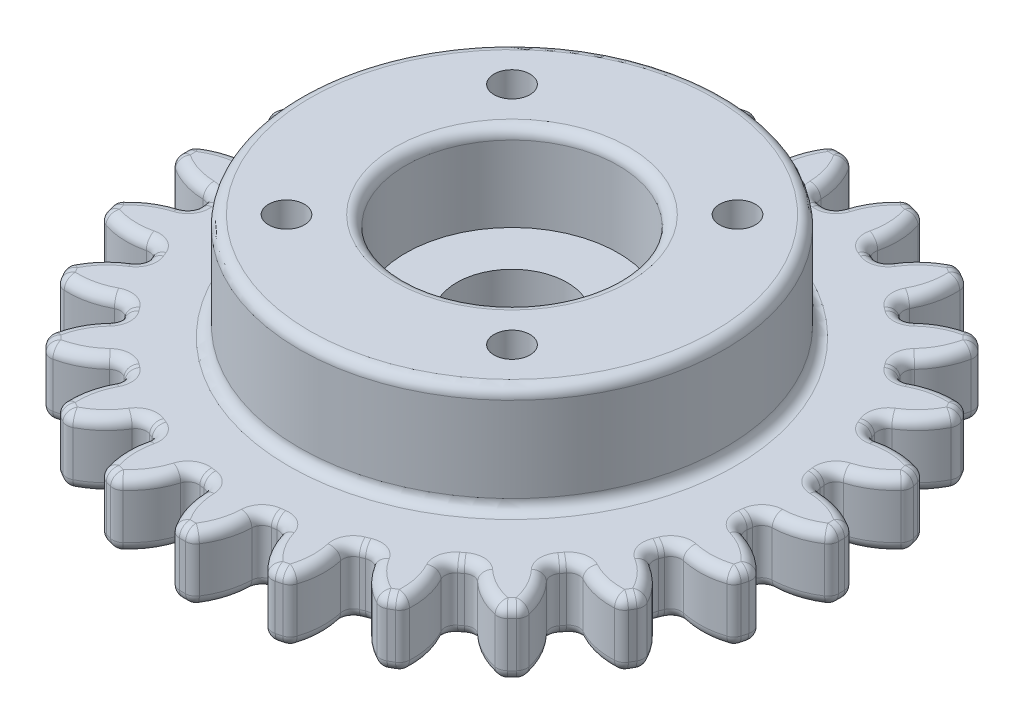
from build123d import *

# Parameters (mm, degrees)
BOSS_EXTRUDE1_DEPTH = 5
SKETCH3_R           = 4.15
CUT_EXTRUDE1_DEPTH  = 36.424021669
SKETCH4_R           = 16
SKETCH4_R_2         = 8
BOSS_EXTRUDE2_DEPTH = 8
SKETCH5_R           = 1.35
CUT_EXTRUDE2_DEPTH  = 6
SKETCH6_R           = 8
SKETCH6_R_2         = 4.15
BOSS_EXTRUDE3_DEPTH = 1.5
FILLET2_R           = 0.8


with BuildPart() as part:
    # Sketch2 → Boss-Extrude1 (new body)
    with BuildSketch(Plane(origin=(0, 0, 0), x_dir=(1, 0, 0), z_dir=(0, 1, 0))):
        with BuildLine():
            ThreePointArc((3.611499267, 20.481830133), (2.714657037, 20.619867355), (1.812647304, 20.718653487))
            ThreePointArc((1.812647304, 20.718653487), (1.606649612, 22.861926713), (0.646923861, 24.78935548))
            ThreePointArc((0.646923861, 24.78935548), (0, 24.797795378), (-0.646923861, 24.78935548))
            ThreePointArc((-0.646923861, 24.78935548), (-1.606649612, 22.861926713), (-1.812647304, 20.718653487))
            ThreePointArc((-1.812647304, 20.718653487), (-2.714657037, 20.619867355), (-3.611499267, 20.481830133))
            ThreePointArc((-3.611499267, 20.481830133), (-4.365197687, 22.498756969), (-5.791076849, 24.112114891))
            ThreePointArc((-5.791076849, 24.112114891), (-6.41814172, 23.95283099), (-7.040837779, 23.777242459))
            ThreePointArc((-7.040837779, 23.777242459), (-7.469006395, 21.667093932), (-7.113264956, 19.543534845))
            ThreePointArc((-7.113264956, 19.543534845), (-7.958971721, 19.214657471), (-8.78952813, 18.849203904))
            ThreePointArc((-8.78952813, 18.849203904), (-10.039563977, 20.602334119), (-11.834425242, 21.791673519))
            ThreePointArc((-11.834425242, 21.791673519), (-12.398897689, 21.475520755), (-12.954930238, 21.144749659))
            ThreePointArc((-12.954930238, 21.144749659), (-12.822362735, 18.995684507), (-11.929125357, 17.0365566))
            ThreePointArc((-11.929125357, 17.0365566), (-12.660895634, 16.500000433), (-13.368565177, 15.932035578))
            ThreePointArc((-13.368565177, 15.932035578), (-15.029750574, 17.301896245), (-17.071277112, 17.98616561))
            ThreePointArc((-17.071277112, 17.98616561), (-17.53468927, 17.53468927), (-17.98616561, 17.071277112))
            ThreePointArc((-17.98616561, 17.071277112), (-17.301896245, 15.029750574), (-15.932035578, 13.368565177))
            ThreePointArc((-15.932035578, 13.368565177), (-16.500000433, 12.660895634), (-17.0365566, 11.929125357))
            ThreePointArc((-17.0365566, 11.929125357), (-18.995684507, 12.822362735), (-21.144749659, 12.954930238))
            ThreePointArc((-21.144749659, 12.954930238), (-21.475520755, 12.398897689), (-21.791673519, 11.834425242))
            ThreePointArc((-21.791673519, 11.834425242), (-20.602334119, 10.039563977), (-18.849203904, 8.78952813))
            ThreePointArc((-18.849203904, 8.78952813), (-19.214657471, 7.958971721), (-19.543534845, 7.113264956))
            ThreePointArc((-19.543534845, 7.113264956), (-21.667093932, 7.469006395), (-23.777242459, 7.040837779))
            ThreePointArc((-23.777242459, 7.040837779), (-23.95283099, 6.41814172), (-24.112114891, 5.791076849))
            ThreePointArc((-24.112114891, 5.791076849), (-22.498756969, 4.365197687), (-20.481830133, 3.611499267))
            ThreePointArc((-20.481830133, 3.611499267), (-20.619867355, 2.714657037), (-20.718653487, 1.812647304))
            ThreePointArc((-20.718653487, 1.812647304), (-22.861926713, 1.606649612), (-24.78935548, 0.646923861))
            ThreePointArc((-24.78935548, 0.646923861), (-24.797795378, 0), (-24.78935548, -0.646923861))
            ThreePointArc((-24.78935548, -0.646923861), (-22.861926713, -1.606649612), (-20.718653487, -1.812647304))
            ThreePointArc((-20.718653487, -1.812647304), (-20.619867355, -2.714657037), (-20.481830133, -3.611499267))
            ThreePointArc((-20.481830133, -3.611499267), (-22.498756969, -4.365197687), (-24.112114891, -5.791076849))
            ThreePointArc((-24.112114891, -5.791076849), (-23.95283099, -6.41814172), (-23.777242459, -7.040837779))
            ThreePointArc((-23.777242459, -7.040837779), (-21.667093932, -7.469006395), (-19.543534845, -7.113264956))
            ThreePointArc((-19.543534845, -7.113264956), (-19.214657471, -7.958971721), (-18.849203904, -8.78952813))
            ThreePointArc((-18.849203904, -8.78952813), (-20.602334119, -10.039563977), (-21.791673519, -11.834425242))
            ThreePointArc((-21.791673519, -11.834425242), (-21.475520755, -12.398897689), (-21.144749659, -12.954930238))
            ThreePointArc((-21.144749659, -12.954930238), (-18.995684507, -12.822362735), (-17.0365566, -11.929125357))
            ThreePointArc((-17.0365566, -11.929125357), (-16.500000433, -12.660895634), (-15.932035578, -13.368565177))
            ThreePointArc((-15.932035578, -13.368565177), (-17.301896245, -15.029750574), (-17.98616561, -17.071277112))
            ThreePointArc((-17.98616561, -17.071277112), (-17.53468927, -17.53468927), (-17.071277112, -17.98616561))
            ThreePointArc((-17.071277112, -17.98616561), (-15.029750574, -17.301896245), (-13.368565177, -15.932035578))
            ThreePointArc((-13.368565177, -15.932035578), (-12.660895634, -16.500000433), (-11.929125357, -17.0365566))
            ThreePointArc((-11.929125357, -17.0365566), (-12.822362735, -18.995684507), (-12.954930238, -21.144749659))
            ThreePointArc((-12.954930238, -21.144749659), (-12.398897689, -21.475520755), (-11.834425242, -21.791673519))
            ThreePointArc((-11.834425242, -21.791673519), (-10.039563977, -20.602334119), (-8.78952813, -18.849203904))
            ThreePointArc((-8.78952813, -18.849203904), (-7.958971721, -19.214657471), (-7.113264956, -19.543534845))
            ThreePointArc((-7.113264956, -19.543534845), (-7.469006395, -21.667093932), (-7.040837779, -23.777242459))
            ThreePointArc((-7.040837779, -23.777242459), (-6.41814172, -23.95283099), (-5.791076849, -24.112114891))
            ThreePointArc((-5.791076849, -24.112114891), (-4.365197687, -22.498756969), (-3.611499267, -20.481830133))
            ThreePointArc((-3.611499267, -20.481830133), (-2.714657037, -20.619867355), (-1.812647304, -20.718653487))
            ThreePointArc((-1.812647304, -20.718653487), (-1.606649612, -22.861926713), (-0.646923861, -24.78935548))
            ThreePointArc((-0.646923861, -24.78935548), (0, -24.797795378), (0.646923861, -24.78935548))
            ThreePointArc((0.646923861, -24.78935548), (1.606649612, -22.861926713), (1.812647304, -20.718653487))
            ThreePointArc((1.812647304, -20.718653487), (2.714657037, -20.619867355), (3.611499267, -20.481830133))
            ThreePointArc((3.611499267, -20.481830133), (4.365197687, -22.498756969), (5.791076849, -24.112114891))
            ThreePointArc((5.791076849, -24.112114891), (6.41814172, -23.95283099), (7.040837779, -23.777242459))
            ThreePointArc((7.040837779, -23.777242459), (7.469006395, -21.667093932), (7.113264956, -19.543534845))
            ThreePointArc((7.113264956, -19.543534845), (7.958971721, -19.214657471), (8.78952813, -18.849203904))
            ThreePointArc((8.78952813, -18.849203904), (10.039563977, -20.602334119), (11.834425242, -21.791673519))
            ThreePointArc((11.834425242, -21.791673519), (12.398897689, -21.475520755), (12.954930238, -21.144749659))
            ThreePointArc((12.954930238, -21.144749659), (12.822362735, -18.995684507), (11.929125357, -17.0365566))
            ThreePointArc((11.929125357, -17.0365566), (12.660895634, -16.500000433), (13.368565177, -15.932035578))
            ThreePointArc((13.368565177, -15.932035578), (15.029750574, -17.301896245), (17.071277112, -17.98616561))
            ThreePointArc((17.071277112, -17.98616561), (17.53468927, -17.53468927), (17.98616561, -17.071277112))
            ThreePointArc((17.98616561, -17.071277112), (17.301896245, -15.029750574), (15.932035578, -13.368565177))
            ThreePointArc((15.932035578, -13.368565177), (16.500000433, -12.660895634), (17.0365566, -11.929125357))
            ThreePointArc((17.0365566, -11.929125357), (18.995684507, -12.822362735), (21.144749659, -12.954930238))
            ThreePointArc((21.144749659, -12.954930238), (21.475520755, -12.398897689), (21.791673519, -11.834425242))
            ThreePointArc((21.791673519, -11.834425242), (20.602334119, -10.039563977), (18.849203904, -8.78952813))
            ThreePointArc((18.849203904, -8.78952813), (19.214657471, -7.958971721), (19.543534845, -7.113264956))
            ThreePointArc((19.543534845, -7.113264956), (21.667093932, -7.469006395), (23.777242459, -7.040837779))
            ThreePointArc((23.777242459, -7.040837779), (23.95283099, -6.41814172), (24.112114891, -5.791076849))
            ThreePointArc((24.112114891, -5.791076849), (22.498756969, -4.365197687), (20.481830133, -3.611499267))
            ThreePointArc((20.481830133, -3.611499267), (20.619867355, -2.714657037), (20.718653487, -1.812647304))
            ThreePointArc((20.718653487, -1.812647304), (22.861926713, -1.606649612), (24.78935548, -0.646923861))
            ThreePointArc((24.78935548, -0.646923861), (24.797795378, 0), (24.78935548, 0.646923861))
            ThreePointArc((24.78935548, 0.646923861), (22.861926713, 1.606649612), (20.718653487, 1.812647304))
            ThreePointArc((20.718653487, 1.812647304), (20.619867355, 2.714657037), (20.481830133, 3.611499267))
            ThreePointArc((20.481830133, 3.611499267), (22.498756969, 4.365197687), (24.112114891, 5.791076849))
            ThreePointArc((24.112114891, 5.791076849), (23.95283099, 6.41814172), (23.777242459, 7.040837779))
            ThreePointArc((23.777242459, 7.040837779), (21.667093932, 7.469006395), (19.543534845, 7.113264956))
            ThreePointArc((19.543534845, 7.113264956), (19.214657471, 7.958971721), (18.849203904, 8.78952813))
            ThreePointArc((18.849203904, 8.78952813), (20.602334119, 10.039563977), (21.791673519, 11.834425242))
            ThreePointArc((21.791673519, 11.834425242), (21.475520755, 12.398897689), (21.144749659, 12.954930238))
            ThreePointArc((21.144749659, 12.954930238), (18.995684507, 12.822362735), (17.0365566, 11.929125357))
            ThreePointArc((17.0365566, 11.929125357), (16.500000433, 12.660895634), (15.932035578, 13.368565177))
            ThreePointArc((15.932035578, 13.368565177), (17.301896245, 15.029750574), (17.98616561, 17.071277112))
            ThreePointArc((17.98616561, 17.071277112), (17.53468927, 17.53468927), (17.071277112, 17.98616561))
            ThreePointArc((17.071277112, 17.98616561), (15.029750574, 17.301896245), (13.368565177, 15.932035578))
            ThreePointArc((13.368565177, 15.932035578), (12.660895634, 16.500000433), (11.929125357, 17.0365566))
            ThreePointArc((11.929125357, 17.0365566), (12.822362735, 18.995684507), (12.954930238, 21.144749659))
            ThreePointArc((12.954930238, 21.144749659), (12.398897689, 21.475520755), (11.834425242, 21.791673519))
            ThreePointArc((11.834425242, 21.791673519), (10.039563977, 20.602334119), (8.78952813, 18.849203904))
            ThreePointArc((8.78952813, 18.849203904), (7.958971721, 19.214657471), (7.113264956, 19.543534845))
            ThreePointArc((7.113264956, 19.543534845), (7.469006395, 21.667093932), (7.040837779, 23.777242459))
            ThreePointArc((7.040837779, 23.777242459), (6.41814172, 23.95283099), (5.791076849, 24.112114891))
            ThreePointArc((5.791076849, 24.112114891), (4.365197687, 22.498756969), (3.611499267, 20.481830133))
        make_face()
    extrude(amount=BOSS_EXTRUDE1_DEPTH)

    # Sketch3 → Cut-Extrude1 (cut, through all)
    with BuildSketch(Plane(origin=(0, 5, 0), x_dir=(1, 0, 0), z_dir=(0, 1, 0))):
        Circle(SKETCH3_R)
    extrude(amount=-CUT_EXTRUDE1_DEPTH, mode=Mode.SUBTRACT)

    # Sketch4 → Boss-Extrude2 (add)
    with BuildSketch(Plane(origin=(0, 5, 0), x_dir=(1, 0, 0), z_dir=(0, 1, 0))):
        Circle(SKETCH4_R)
        Circle(SKETCH4_R_2, mode=Mode.SUBTRACT)
    extrude(amount=BOSS_EXTRUDE2_DEPTH)

    # Sketch5 → Cut-Extrude2 (cut)
    with BuildSketch(Plane(origin=(0, 13, 0), x_dir=(1, 0, 0), z_dir=(0, 1, 0))):
        with Locations((8.485281374, 8.485281374)):
            Circle(SKETCH5_R)
        with Locations((-8.485281374, 8.485281374)):
            Circle(SKETCH5_R)
        with Locations((-8.485281374, -8.485281374)):
            Circle(SKETCH5_R)
        with Locations((8.485281374, -8.485281374)):
            Circle(SKETCH5_R)
    extrude(amount=-CUT_EXTRUDE2_DEPTH, mode=Mode.SUBTRACT)

    # Sketch6 → Boss-Extrude3 (add)
    with BuildSketch(Plane(origin=(0, 5, 0), x_dir=(1, 0, 0), z_dir=(0, 1, 0))):
        Circle(SKETCH6_R)
        Circle(SKETCH6_R_2, mode=Mode.SUBTRACT)
    extrude(amount=BOSS_EXTRUDE3_DEPTH)

    # Fillet2
    fillet2_edges = [part.edges().sort_by_distance(p)[0] for p in [
        (-3.611499267, 2.5, -20.481830133),
        (-5.791076849, 2.5, -24.112114891),
        (-7.040837779, 2.5, -23.777242459),
        (-7.113264956, 2.5, -19.543534845),
        (-8.78952813, 2.5, -18.849203904),
        (-11.834425242, 2.5, -21.791673519),
        (-12.954930238, 2.5, -21.144749659),
        (-11.929125357, 2.5, -17.0365566),
        (-13.368565177, 2.5, -15.932035578),
        (-17.071277112, 2.5, -17.98616561),
        (-17.98616561, 2.5, -17.071277112),
        (-15.932035578, 2.5, -13.368565177),
        (-17.0365566, 2.5, -11.929125357),
        (-21.144749659, 2.5, -12.954930238),
        (-21.791673519, 2.5, -11.834425242),
        (-18.849203904, 2.5, -8.78952813),
        (-19.543534845, 2.5, -7.113264956),
        (-23.777242459, 2.5, -7.040837779),
        (-24.112114891, 2.5, -5.791076849),
        (-20.481830133, 2.5, -3.611499267),
        (-20.718653487, 2.5, -1.812647304),
        (-24.78935548, 2.5, -0.646923861),
        (-24.78935548, 2.5, 0.646923861),
        (-20.718653487, 2.5, 1.812647304),
        (-20.481830133, 2.5, 3.611499267),
        (-24.112114891, 2.5, 5.791076849),
        (-23.777242459, 2.5, 7.040837779),
        (-19.543534845, 2.5, 7.113264956),
        (-18.849203904, 2.5, 8.78952813),
        (-21.791673519, 2.5, 11.834425242),
        (-21.144749659, 2.5, 12.954930238),
        (-17.0365566, 2.5, 11.929125357),
        (-15.932035578, 2.5, 13.368565177),
        (-17.98616561, 2.5, 17.071277112),
        (-17.071277112, 2.5, 17.98616561),
        (-13.368565177, 2.5, 15.932035578),
        (-11.929125357, 2.5, 17.0365566),
        (-12.954930238, 2.5, 21.144749659),
        (-11.834425242, 2.5, 21.791673519),
        (-8.78952813, 2.5, 18.849203904),
        (-7.113264956, 2.5, 19.543534845),
        (-7.040837779, 2.5, 23.777242459),
        (-5.791076849, 2.5, 24.112114891),
        (-3.611499267, 2.5, 20.481830133),
        (-1.812647304, 2.5, 20.718653487),
        (-0.646923861, 2.5, 24.78935548),
        (0.646923861, 2.5, 24.78935548),
        (1.812647304, 2.5, 20.718653487),
        (3.611499267, 2.5, 20.481830133),
        (5.791076849, 2.5, 24.112114891),
        (7.040837779, 2.5, 23.777242459),
        (7.113264956, 2.5, 19.543534845),
        (8.78952813, 2.5, 18.849203904),
        (11.834425242, 2.5, 21.791673519),
        (12.954930238, 2.5, 21.144749659),
        (11.929125357, 2.5, 17.0365566),
        (13.368565177, 2.5, 15.932035578),
        (17.071277112, 2.5, 17.98616561),
        (17.98616561, 2.5, 17.071277112),
        (15.932035578, 2.5, 13.368565177),
        (17.0365566, 2.5, 11.929125357),
        (21.144749659, 2.5, 12.954930238),
        (21.791673519, 2.5, 11.834425242),
        (18.849203904, 2.5, 8.78952813),
        (19.543534845, 2.5, 7.113264956),
        (23.777242459, 2.5, 7.040837779),
        (24.112114891, 2.5, 5.791076849),
        (20.481830133, 2.5, 3.611499267),
        (20.718653487, 2.5, 1.812647304),
        (24.78935548, 2.5, 0.646923861),
        (24.78935548, 2.5, -0.646923861),
        (20.718653487, 2.5, -1.812647304),
        (20.481830133, 2.5, -3.611499267),
        (24.112114891, 2.5, -5.791076849),
        (23.777242459, 2.5, -7.040837779),
        (19.543534845, 2.5, -7.113264956),
        (18.849203904, 2.5, -8.78952813),
        (21.791673519, 2.5, -11.834425242),
        (21.144749659, 2.5, -12.954930238),
        (17.0365566, 2.5, -11.929125357),
        (15.932035578, 2.5, -13.368565177),
        (17.98616561, 2.5, -17.071277112),
        (17.071277112, 2.5, -17.98616561),
        (13.368565177, 2.5, -15.932035578),
        (11.929125357, 2.5, -17.0365566),
        (12.954930238, 2.5, -21.144749659),
        (11.834425242, 2.5, -21.791673519),
        (8.78952813, 2.5, -18.849203904),
        (7.113264956, 2.5, -19.543534845),
        (7.040837779, 2.5, -23.777242459),
        (5.791076849, 2.5, -24.112114891),
        (3.611499267, 2.5, -20.481830133),
        (1.812647304, 2.5, -20.718653487),
        (0.646923861, 2.5, -24.78935548),
        (-0.646923861, 2.5, -24.78935548),
        (-1.812647304, 2.5, -20.718653487),
        (-1.606649612, 5, -22.861926713),
        (0, 5, -24.797795378),
        (1.606649612, 5, -22.861926713),
        (2.714657037, 5, -20.619867355),
        (4.365197687, 5, -22.498756969),
        (6.41814172, 5, -23.95283099),
        (7.469006395, 5, -21.667093932),
        (7.958971721, 5, -19.214657471),
        (10.039563977, 5, -20.602334119),
        (12.398897689, 5, -21.475520755),
        (12.822362735, 5, -18.995684507),
        (12.660895634, 5, -16.500000433),
        (15.029750574, 5, -17.301896245),
        (17.53468927, 5, -17.53468927),
        (17.301896245, 5, -15.029750574),
        (16.500000433, 5, -12.660895634),
        (18.995684507, 5, -12.822362735),
        (21.475520755, 5, -12.398897689),
        (20.602334119, 5, -10.039563977),
        (19.214657471, 5, -7.958971721),
        (21.667093932, 5, -7.469006395),
        (23.95283099, 5, -6.41814172),
        (22.498756969, 5, -4.365197687),
        (20.619867355, 5, -2.714657037),
        (22.861926713, 5, -1.606649612),
        (24.797795378, 5, 0),
        (22.861926713, 5, 1.606649612),
        (20.619867355, 5, 2.714657037),
        (22.498756969, 5, 4.365197687),
        (23.95283099, 5, 6.41814172),
        (21.667093932, 5, 7.469006395),
        (19.214657471, 5, 7.958971721),
        (20.602334119, 5, 10.039563977),
        (21.475520755, 5, 12.398897689),
        (18.995684507, 5, 12.822362735),
        (16.500000433, 5, 12.660895634),
        (17.301896245, 5, 15.029750574),
        (17.53468927, 5, 17.53468927),
        (15.029750574, 5, 17.301896245),
        (12.660895634, 5, 16.500000433),
        (12.822362735, 5, 18.995684507),
        (12.398897689, 5, 21.475520755),
        (10.039563977, 5, 20.602334119),
        (7.958971721, 5, 19.214657471),
        (7.469006395, 5, 21.667093932),
        (6.41814172, 5, 23.95283099),
        (4.365197687, 5, 22.498756969),
        (2.714657037, 5, 20.619867355),
        (1.606649612, 5, 22.861926713),
        (0, 5, 24.797795378),
        (-1.606649612, 5, 22.861926713),
        (-2.714657037, 5, 20.619867355),
        (-4.365197687, 5, 22.498756969),
        (-6.41814172, 5, 23.95283099),
        (-7.469006395, 5, 21.667093932),
        (-7.958971721, 5, 19.214657471),
        (-10.039563977, 5, 20.602334119),
        (-12.398897689, 5, 21.475520755),
        (-12.822362735, 5, 18.995684507),
        (-12.660895634, 5, 16.500000433),
        (-15.029750574, 5, 17.301896245),
        (-17.53468927, 5, 17.53468927),
        (-17.301896245, 5, 15.029750574),
        (-16.500000433, 5, 12.660895634),
        (-18.995684507, 5, 12.822362735),
        (-21.475520755, 5, 12.398897689),
        (-20.602334119, 5, 10.039563977),
        (-19.214657471, 5, 7.958971721),
        (-21.667093932, 5, 7.469006395),
        (-23.95283099, 5, 6.41814172),
        (-22.498756969, 5, 4.365197687),
        (-20.619867355, 5, 2.714657037),
        (-22.861926713, 5, 1.606649612),
        (-24.797795378, 5, 0),
        (-22.861926713, 5, -1.606649612),
        (-20.619867355, 5, -2.714657037),
        (-22.498756969, 5, -4.365197687),
        (-23.95283099, 5, -6.41814172),
        (-21.667093932, 5, -7.469006395),
        (-19.214657471, 5, -7.958971721),
        (-20.602334119, 5, -10.039563977),
        (-21.475520755, 5, -12.398897689),
        (-18.995684507, 5, -12.822362735),
        (-16.500000433, 5, -12.660895634),
        (-17.301896245, 5, -15.029750574),
        (-17.53468927, 5, -17.53468927),
        (-15.029750574, 5, -17.301896245),
        (-12.660895634, 5, -16.500000433),
        (-12.822362735, 5, -18.995684507),
        (-12.398897689, 5, -21.475520755),
        (-10.039563977, 5, -20.602334119),
        (-7.958971721, 5, -19.214657471),
        (-7.469006395, 5, -21.667093932),
        (-6.41814172, 5, -23.95283099),
        (-4.365197687, 5, -22.498756969),
        (-2.714657037, 5, -20.619867355),
        (-1.606649612, 0, -22.861926713),
        (0, 0, -24.797795378),
        (1.606649612, 0, -22.861926713),
        (2.714657037, 0, -20.619867355),
        (4.365197687, 0, -22.498756969),
        (6.41814172, 0, -23.95283099),
        (7.469006395, 0, -21.667093932),
        (7.958971721, 0, -19.214657471),
        (10.039563977, 0, -20.602334119),
        (12.398897689, 0, -21.475520755),
        (12.822362735, 0, -18.995684507),
        (12.660895634, 0, -16.500000433),
        (15.029750574, 0, -17.301896245),
        (17.53468927, 0, -17.53468927),
        (17.301896245, 0, -15.029750574),
        (16.500000433, 0, -12.660895634),
        (18.995684507, 0, -12.822362735),
        (21.475520755, 0, -12.398897689),
        (20.602334119, 0, -10.039563977),
        (19.214657471, 0, -7.958971721),
        (21.667093932, 0, -7.469006395),
        (23.95283099, 0, -6.41814172),
        (22.498756969, 0, -4.365197687),
        (20.619867355, 0, -2.714657037),
        (22.861926713, 0, -1.606649612),
        (24.797795378, 0, 0),
        (22.861926713, 0, 1.606649612),
        (20.619867355, 0, 2.714657037),
        (22.498756969, 0, 4.365197687),
        (23.95283099, 0, 6.41814172),
        (21.667093932, 0, 7.469006395),
        (19.214657471, 0, 7.958971721),
        (20.602334119, 0, 10.039563977),
        (21.475520755, 0, 12.398897689),
        (18.995684507, 0, 12.822362735),
        (16.500000433, 0, 12.660895634),
        (17.301896245, 0, 15.029750574),
        (17.53468927, 0, 17.53468927),
        (15.029750574, 0, 17.301896245),
        (12.660895634, 0, 16.500000433),
        (12.822362735, 0, 18.995684507),
        (12.398897689, 0, 21.475520755),
        (10.039563977, 0, 20.602334119),
        (7.958971721, 0, 19.214657471),
        (7.469006395, 0, 21.667093932),
        (6.41814172, 0, 23.95283099),
        (4.365197687, 0, 22.498756969),
        (2.714657037, 0, 20.619867355),
        (1.606649612, 0, 22.861926713),
        (0, 0, 24.797795378),
        (-1.606649612, 0, 22.861926713),
        (-2.714657037, 0, 20.619867355),
        (-4.365197687, 0, 22.498756969),
        (-6.41814172, 0, 23.95283099),
        (-7.469006395, 0, 21.667093932),
        (-7.958971721, 0, 19.214657471),
        (-10.039563977, 0, 20.602334119),
        (-12.398897689, 0, 21.475520755),
        (-12.822362735, 0, 18.995684507),
        (-12.660895634, 0, 16.500000433),
        (-15.029750574, 0, 17.301896245),
        (-17.53468927, 0, 17.53468927),
        (-17.301896245, 0, 15.029750574),
        (-16.500000433, 0, 12.660895634),
        (-18.995684507, 0, 12.822362735),
        (-21.475520755, 0, 12.398897689),
        (-20.602334119, 0, 10.039563977),
        (-19.214657471, 0, 7.958971721),
        (-21.667093932, 0, 7.469006395),
        (-23.95283099, 0, 6.41814172),
        (-22.498756969, 0, 4.365197687),
        (-20.619867355, 0, 2.714657037),
        (-22.861926713, 0, 1.606649612),
        (-24.797795378, 0, 0),
        (-22.861926713, 0, -1.606649612),
        (-20.619867355, 0, -2.714657037),
        (-22.498756969, 0, -4.365197687),
        (-23.95283099, 0, -6.41814172),
        (-21.667093932, 0, -7.469006395),
        (-19.214657471, 0, -7.958971721),
        (-20.602334119, 0, -10.039563977),
        (-21.475520755, 0, -12.398897689),
        (-18.995684507, 0, -12.822362735),
        (-16.500000433, 0, -12.660895634),
        (-17.301896245, 0, -15.029750574),
        (-17.53468927, 0, -17.53468927),
        (-15.029750574, 0, -17.301896245),
        (-12.660895634, 0, -16.500000433),
        (-12.822362735, 0, -18.995684507),
        (-12.398897689, 0, -21.475520755),
        (-10.039563977, 0, -20.602334119),
        (-7.958971721, 0, -19.214657471),
        (-7.469006395, 0, -21.667093932),
        (-6.41814172, 0, -23.95283099),
        (-4.365197687, 0, -22.498756969),
        (-2.714657037, 0, -20.619867355),
        (-8, 13, 0),
        (-16, 5, 0),
        (-16, 13, 0),
    ]]
    fillet(fillet2_edges, radius=FILLET2_R)


solid = part.part
